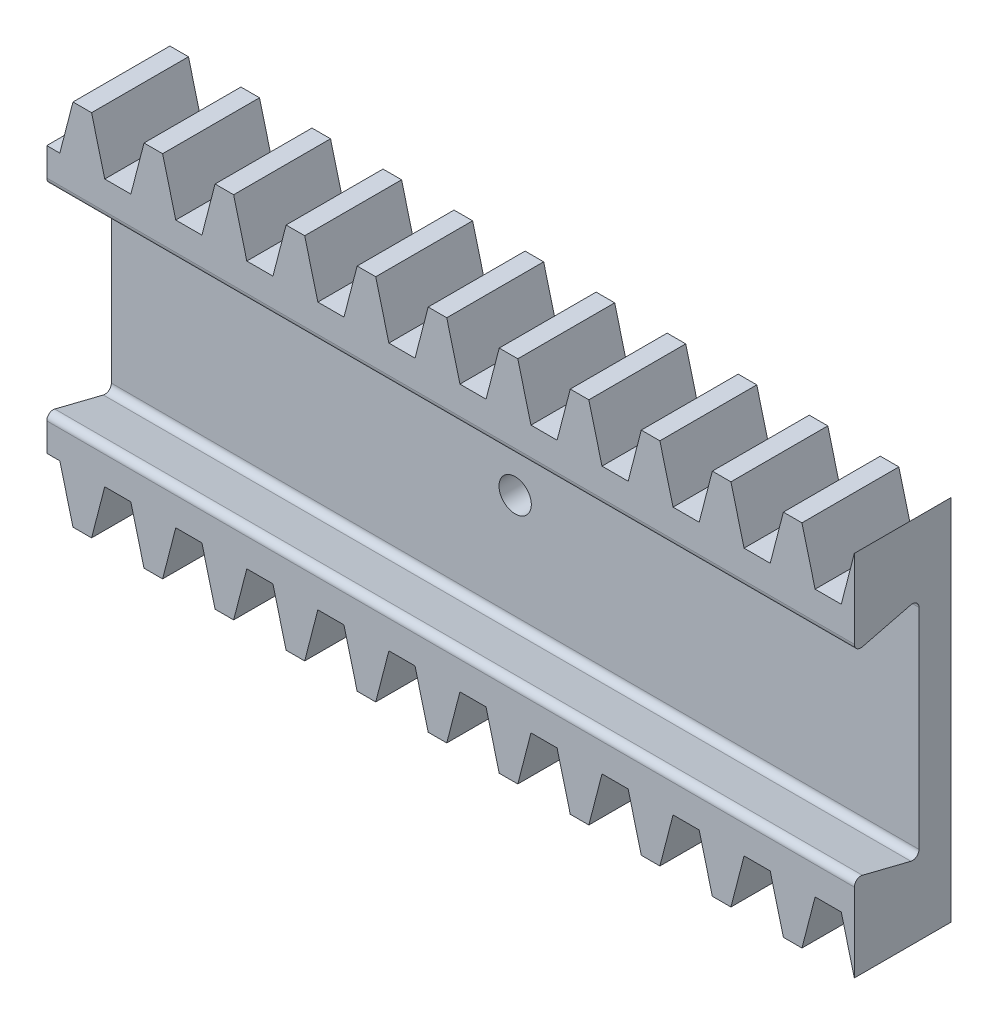
from build123d import *

# Parameters (mm, degrees)
BLANKSKE_W             = 25
BLANKSKE_H             = 5.7
BLANK_DEPTH            = 3
TOOTHCUTSIM_DEPTH      = 26.816467613
TEETHCUTS_COUNT        = 13
TEETHCUTS_PITCH        = 2.199114855
MIRROR_2_COPY_1_DEPTH  = 26.816467613
MIRROR_2_COPY_2_DEPTH  = 26.816467613
MIRROR_2_COPY_3_DEPTH  = 26.816467613
MIRROR_2_COPY_4_DEPTH  = 26.816467613
MIRROR_2_COPY_5_DEPTH  = 26.816467613
MIRROR_2_COPY_6_DEPTH  = 26.816467613
MIRROR_2_COPY_7_DEPTH  = 26.816467613
MIRROR_2_COPY_8_DEPTH  = 26.816467613
MIRROR_2_COPY_9_DEPTH  = 26.816467613
MIRROR_2_COPY_10_DEPTH = 26.816467613
MIRROR_2_COPY_11_DEPTH = 26.816467613
MIRROR_2_COPY_12_DEPTH = 26.816467613
CUT_EXTRUDE_2_DEPTH    = 26.816467613
FILLET_1_R             = 0.2
FILLET_2_R             = 0.2
FILLET_3_R             = 0.2
SKETCH_2_R             = 1.5
EXTRUDE_1_DEPTH        = 1.5
SKETCH_3_R             = 0.5
CUT_EXTRUDE_3_DEPTH    = 27.033440034


with BuildPart() as part:
    # BlankSke → Blank (new body)
    with BuildSketch(Plane.XY):
        with Locations((12.5, 2.85)):
            Rectangle(BLANKSKE_W, BLANKSKE_H)
    blank = extrude(amount=-BLANK_DEPTH)

    # TooCutSkeSim → ToothCutSim (cut, through all)
    with BuildSketch(Plane.XY):
        Polygon((0.404488327, 4.125), (-0.404488327, 4.125), (-0.818379909, 5.7254), (0.818379909, 5.7254), align=None)
    toothcutsim = extrude(amount=-TOOTHCUTSIM_DEPTH, mode=Mode.SUBTRACT)

    # TeethCuts: ToothCutSim ×13
    with Locations(*[(i * TEETHCUTS_PITCH, 0, 0) for i in range(1, TEETHCUTS_COUNT)]):
        add(toothcutsim, mode=Mode.SUBTRACT)

    # 镜向2: Blank, ToothCutSim across plane
    add(blank.mirror(Plane(origin=(0, 0, -3), x_dir=(0, 0, 1), z_dir=(0, -1, 0))))
    add(toothcutsim.mirror(Plane(origin=(0, 0, -3), x_dir=(0, 0, 1), z_dir=(0, -1, 0))), mode=Mode.SUBTRACT)

    # 镜向2 copy 1 sketch → 镜向2 copy 1 (cut, through all)
    with BuildSketch(Plane(origin=(2.199114855, 0, 0), x_dir=(1, 0, 0), z_dir=(0, 0, 1))):
        Polygon((0.404488327, -4.125), (-0.404488327, -4.125), (-0.818379909, -5.7254), (0.818379909, -5.7254), align=None)
    extrude(amount=-MIRROR_2_COPY_1_DEPTH, mode=Mode.SUBTRACT)

    # 镜向2 copy 2 sketch → 镜向2 copy 2 (cut, through all)
    with BuildSketch(Plane(origin=(4.39822971, 0, 0), x_dir=(1, 0, 0), z_dir=(0, 0, 1))):
        Polygon((0.404488327, -4.125), (-0.404488327, -4.125), (-0.818379909, -5.7254), (0.818379909, -5.7254), align=None)
    extrude(amount=-MIRROR_2_COPY_2_DEPTH, mode=Mode.SUBTRACT)

    # 镜向2 copy 3 sketch → 镜向2 copy 3 (cut, through all)
    with BuildSketch(Plane(origin=(6.597344565, 0, 0), x_dir=(1, 0, 0), z_dir=(0, 0, 1))):
        Polygon((0.404488327, -4.125), (-0.404488327, -4.125), (-0.818379909, -5.7254), (0.818379909, -5.7254), align=None)
    extrude(amount=-MIRROR_2_COPY_3_DEPTH, mode=Mode.SUBTRACT)

    # 镜向2 copy 4 sketch → 镜向2 copy 4 (cut, through all)
    with BuildSketch(Plane(origin=(8.79645942, 0, 0), x_dir=(1, 0, 0), z_dir=(0, 0, 1))):
        Polygon((0.404488327, -4.125), (-0.404488327, -4.125), (-0.818379909, -5.7254), (0.818379909, -5.7254), align=None)
    extrude(amount=-MIRROR_2_COPY_4_DEPTH, mode=Mode.SUBTRACT)

    # 镜向2 copy 5 sketch → 镜向2 copy 5 (cut, through all)
    with BuildSketch(Plane(origin=(10.995574275, 0, 0), x_dir=(1, 0, 0), z_dir=(0, 0, 1))):
        Polygon((0.404488327, -4.125), (-0.404488327, -4.125), (-0.818379909, -5.7254), (0.818379909, -5.7254), align=None)
    extrude(amount=-MIRROR_2_COPY_5_DEPTH, mode=Mode.SUBTRACT)

    # 镜向2 copy 6 sketch → 镜向2 copy 6 (cut, through all)
    with BuildSketch(Plane(origin=(13.19468913, 0, 0), x_dir=(1, 0, 0), z_dir=(0, 0, 1))):
        Polygon((0.404488327, -4.125), (-0.404488327, -4.125), (-0.818379909, -5.7254), (0.818379909, -5.7254), align=None)
    extrude(amount=-MIRROR_2_COPY_6_DEPTH, mode=Mode.SUBTRACT)

    # 镜向2 copy 7 sketch → 镜向2 copy 7 (cut, through all)
    with BuildSketch(Plane(origin=(15.393803985, 0, 0), x_dir=(1, 0, 0), z_dir=(0, 0, 1))):
        Polygon((0.404488327, -4.125), (-0.404488327, -4.125), (-0.818379909, -5.7254), (0.818379909, -5.7254), align=None)
    extrude(amount=-MIRROR_2_COPY_7_DEPTH, mode=Mode.SUBTRACT)

    # 镜向2 copy 8 sketch → 镜向2 copy 8 (cut, through all)
    with BuildSketch(Plane(origin=(17.59291884, 0, 0), x_dir=(1, 0, 0), z_dir=(0, 0, 1))):
        Polygon((0.404488327, -4.125), (-0.404488327, -4.125), (-0.818379909, -5.7254), (0.818379909, -5.7254), align=None)
    extrude(amount=-MIRROR_2_COPY_8_DEPTH, mode=Mode.SUBTRACT)

    # 镜向2 copy 9 sketch → 镜向2 copy 9 (cut, through all)
    with BuildSketch(Plane(origin=(19.792033695, 0, 0), x_dir=(1, 0, 0), z_dir=(0, 0, 1))):
        Polygon((0.404488327, -4.125), (-0.404488327, -4.125), (-0.818379909, -5.7254), (0.818379909, -5.7254), align=None)
    extrude(amount=-MIRROR_2_COPY_9_DEPTH, mode=Mode.SUBTRACT)

    # 镜向2 copy 10 sketch → 镜向2 copy 10 (cut, through all)
    with BuildSketch(Plane(origin=(21.99114855, 0, 0), x_dir=(1, 0, 0), z_dir=(0, 0, 1))):
        Polygon((0.404488327, -4.125), (-0.404488327, -4.125), (-0.818379909, -5.7254), (0.818379909, -5.7254), align=None)
    extrude(amount=-MIRROR_2_COPY_10_DEPTH, mode=Mode.SUBTRACT)

    # 镜向2 copy 11 sketch → 镜向2 copy 11 (cut, through all)
    with BuildSketch(Plane(origin=(24.190263405, 0, 0), x_dir=(1, 0, 0), z_dir=(0, 0, 1))):
        Polygon((0.404488327, -4.125), (-0.404488327, -4.125), (-0.818379909, -5.7254), (0.818379909, -5.7254), align=None)
    extrude(amount=-MIRROR_2_COPY_11_DEPTH, mode=Mode.SUBTRACT)

    # 镜向2 copy 12 sketch → 镜向2 copy 12 (cut, through all)
    with BuildSketch(Plane(origin=(26.38937826, 0, 0), x_dir=(1, 0, 0), z_dir=(0, 0, 1))):
        Polygon((0.404488327, -4.125), (-0.404488327, -4.125), (-0.818379909, -5.7254), (0.818379909, -5.7254), align=None)
    extrude(amount=-MIRROR_2_COPY_12_DEPTH, mode=Mode.SUBTRACT)

    # 草图1 → 切除-拉伸2 (cut, through all)
    with BuildSketch(Plane.ZY):
        Polygon((0, -3), (0, 3), (-2, 3.5), (-2, -3.5), align=None)
    extrude(amount=-CUT_EXTRUDE_2_DEPTH, mode=Mode.SUBTRACT)

    # 圆角1
    fillet_1_edges = [part.edges().sort_by_distance(p)[0] for p in [
        (12.5, -3.5, -2),
    ]]
    fillet(fillet_1_edges, radius=FILLET_1_R)

    # 圆角2
    fillet_2_edges = [part.edges().sort_by_distance(p)[0] for p in [
        (12.5, 3.5, -2),
    ]]
    fillet(fillet_2_edges, radius=FILLET_2_R)

    # 圆角3
    fillet_3_edges = [part.edges().sort_by_distance(p)[0] for p in [
        (12.5, -3, 0),
        (12.5, 3, 0),
    ]]
    fillet(fillet_3_edges, radius=FILLET_3_R)

    # 草图2 → 凸台-拉伸1 (add)
    with BuildSketch(Plane(origin=(0, 0, -3), x_dir=(-1, 0, 0), z_dir=(0, 0, -1))):
        with Locations((-12.5, 0)):
            Circle(SKETCH_2_R)
    extrude(amount=EXTRUDE_1_DEPTH)

    # 草图3 → 切除-拉伸3 (cut, through all)
    with BuildSketch(Plane(origin=(0, 0, -4.5), x_dir=(-1, 0, 0), z_dir=(0, 0, -1))):
        with Locations((-12.5, 0)):
            Circle(SKETCH_3_R)
    extrude(amount=-CUT_EXTRUDE_3_DEPTH, mode=Mode.SUBTRACT)


solid = part.part
